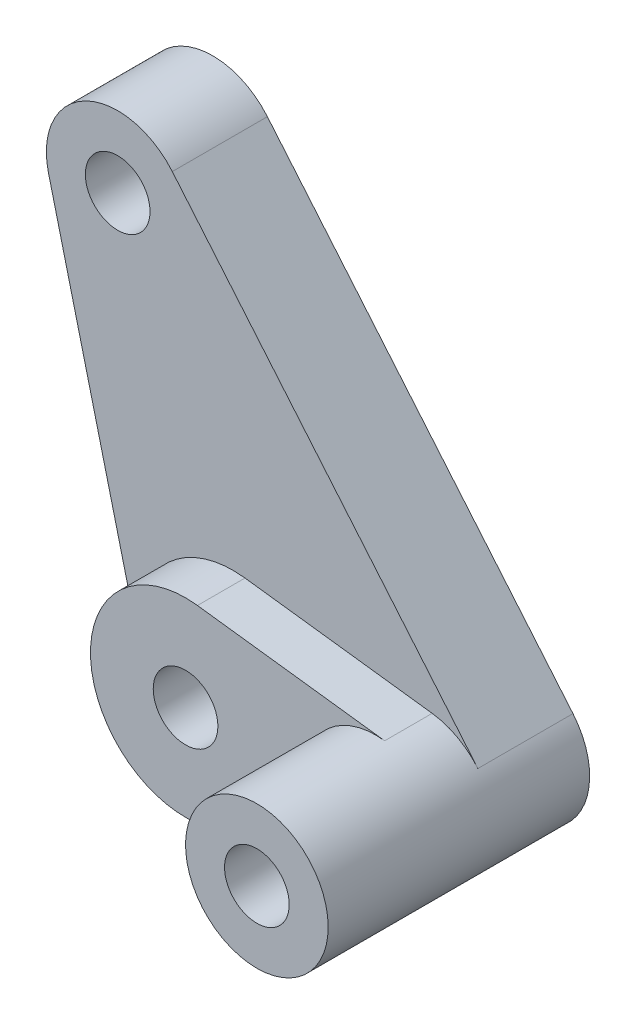
from build123d import *

# Parameters (mm, degrees)
SKETCH1_R           = 2.159
BOSS_EXTRUDE1_DEPTH = 3.175
SKETCH3_R           = 4.7625
SKETCH3_R_2         = 2.159
BOSS_EXTRUDE2_DEPTH = 11.1125
CUT_EXTRUDE1_DEPTH  = 3.175
BOSS_EXTRUDE3_START = 3.175
SKETCH5_R           = 2.159
BOSS_EXTRUDE3_DEPTH = 3.175


with BuildPart() as part:
    # Sketch1 → Boss-Extrude1 (new, symmetric)
    with BuildSketch(Plane.XY):
        with BuildLine():
            Line((0.5953125, -4.725146482), (-11.90625, -6.300195309))
            ThreePointArc((-11.90625, -6.300195309), (-16.287594454, -5.239433752), (-18.860893238, -1.538146453))
            Line((-18.860893238, -1.538146453), (-25.029176536, 23.16830123))
            ThreePointArc((-25.029176536, 23.16830123), (-22.571305245, 28.564988761), (-16.760219947, 27.38318706))
            Line((-16.760219947, 27.38318706), (3.64828666, 3.061275991))
            ThreePointArc((3.64828666, 3.061275991), (4.433861431, -1.738470321), (0.5953125, -4.725146482))
        make_face()
        with Locations((-12.7, 0)):
            Circle(SKETCH1_R, mode=Mode.SUBTRACT)
        with Locations((-20.408506608, 24.321911069)):
            Circle(SKETCH1_R, mode=Mode.SUBTRACT)
        Circle(SKETCH1_R, mode=Mode.SUBTRACT)
    extrude(amount=BOSS_EXTRUDE1_DEPTH, both=True)

    # Sketch3 → Boss-Extrude2 (add)
    with BuildSketch(Plane.XY.offset(3.175)):
        Circle(SKETCH3_R)
        Circle(SKETCH3_R_2, mode=Mode.SUBTRACT)
    extrude(amount=BOSS_EXTRUDE2_DEPTH)

    # Sketch4 → Cut-Extrude1 (cut)
    with BuildSketch(Plane(origin=(0, 0, -3.175), x_dir=(-1, 0, 0), z_dir=(0, 0, -1))):
        Polygon((12.7, 5.132643893), (8.255, 2.566321947), (8.255, -2.566321947), (12.7, -5.132643893), (17.145, -2.566321947), (17.145, 2.566321947), align=None)
    extrude(amount=-CUT_EXTRUDE1_DEPTH, mode=Mode.SUBTRACT)

    # Sketch5 → Boss-Extrude3 (add)
    with BuildSketch(Plane.XY.offset(3.175).offset(BOSS_EXTRUDE3_START)):
        with BuildLine():
            Line((-11.90625, 6.300195309), (0.5953125, 4.725146482))
            ThreePointArc((0.5953125, 4.725146482), (-4.7625, 0), (0.5953125, -4.725146482))
            Line((0.5953125, -4.725146482), (-11.90625, -6.300195309))
            ThreePointArc((-11.90625, -6.300195309), (-19.05, 0), (-11.90625, 6.300195309))
        make_face()
        with Locations((-12.7, 0)):
            Circle(SKETCH5_R, mode=Mode.SUBTRACT)
    extrude(amount=-BOSS_EXTRUDE3_DEPTH)


solid = part.part
